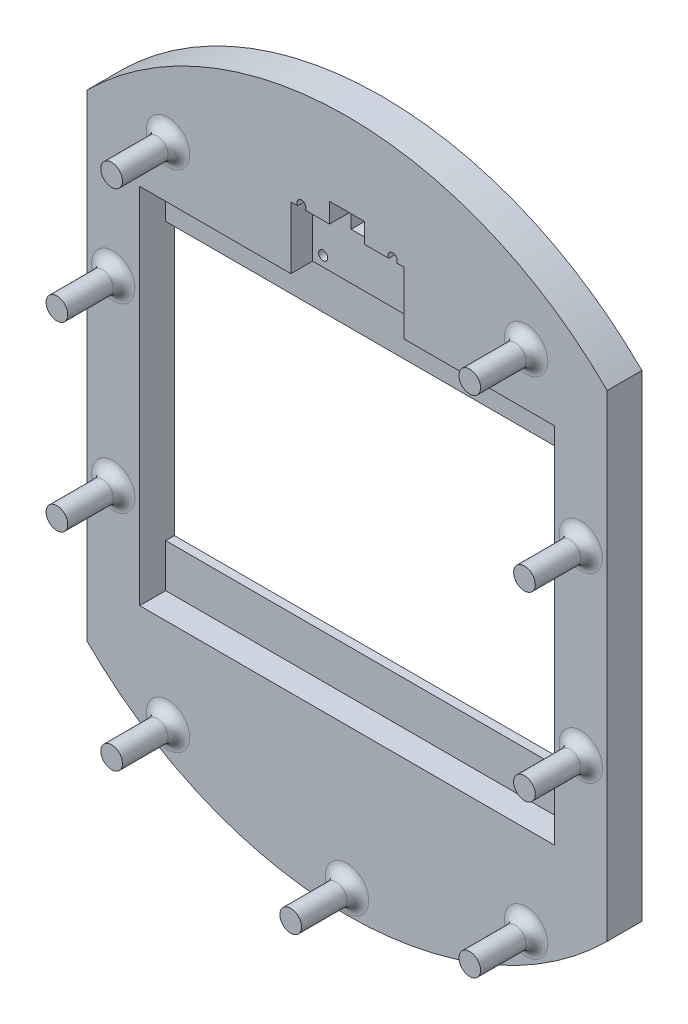
from build123d import *

# Parameters (mm, degrees)
ESBO_O1_W                = 95.625
ESBO_O1_H                = 63.75
RESSALTO_EXTRUS_O1_DEPTH = 8
ESBO_O2_W                = 95.625
ESBO_O2_H                = 83.75
CORTE_EXTRUS_O1_DEPTH    = 6
ESBO_O3_R                = 2.5
RESSALTO_EXTRUS_O2_DEPTH = 13
FILETE1_R                = 2.5
ESBO_O4_R                = 1.05
ESBO_O4_W                = 8.1
ESBO_O4_H                = 8.1
CORTE_EXTRUS_O2_DEPTH    = 14
CORTE_EXTRUS_O3_DEPTH    = 5


with BuildPart() as part:
    # Esboço1 → Ressalto-extrusão1 (new body)
    with BuildSketch(Plane.XY):
        with BuildLine():
            Line((0, 0), (0, -110))
            ThreePointArc((0, -110), (60, -134.792027106), (120, -110))
            Line((120, -110), (120, 0))
            ThreePointArc((120, 0), (60, 24.792027106), (0, 0))
        make_face()
        with Locations((60, -55)):
            Rectangle(ESBO_O1_W, ESBO_O1_H, mode=Mode.SUBTRACT)
    extrude(amount=RESSALTO_EXTRUS_O1_DEPTH)

    # Esboço2 → Corte-extrusão1 (cut)
    with BuildSketch(Plane.XY.offset(8)):
        with Locations((60, -55)):
            Rectangle(ESBO_O2_W, ESBO_O2_H)
    extrude(amount=-CORTE_EXTRUS_O1_DEPTH, mode=Mode.SUBTRACT)

    # Esboço3 → Ressalto-extrusão2 (add)
    with BuildSketch(Plane.XY.offset(8)):
        with Locations((18.70841508, -117.382967977)):
            Circle(ESBO_O3_R)
        with Locations((60, -129.382503442)):
            Circle(ESBO_O3_R)
        with Locations((101.29158492, -117.382967977)):
            Circle(ESBO_O3_R)
        with Locations((101.29158492, -1.064839346)):
            Circle(ESBO_O3_R)
        with Locations((18.70841508, -1.064839346)):
            Circle(ESBO_O3_R)
        with Locations((6.09375, -75.94)):
            Circle(ESBO_O3_R)
        with Locations((6.09375, -34.065)):
            Circle(ESBO_O3_R)
        with Locations((113.90625, -75.94)):
            Circle(ESBO_O3_R)
        with Locations((113.90625, -34.065)):
            Circle(ESBO_O3_R)
    extrude(amount=RESSALTO_EXTRUS_O2_DEPTH)

    # Filete1
    filete1_edges = [part.edges().sort_by_distance(p)[0] for p in [
        (16.20841508, -1.064839346, 8),
        (3.59375, -34.065, 8),
        (3.59375, -75.94, 8),
        (16.20841508, -117.382967977, 8),
        (57.5, -129.382503442, 8),
        (98.79158492, -117.382967977, 8),
        (111.40625, -75.94, 8),
        (111.40625, -34.065, 8),
        (98.79158492, -1.064839346, 8),
    ]]
    fillet(filete1_edges, radius=FILETE1_R)

    # Esboço4 → Corte-extrusão2 (cut)
    with BuildSketch(Plane.XY.offset(8)):
        with Locations((70.5, -10.765932159)):
            Circle(ESBO_O4_R)
        with Locations((70.5, 1.734067841)):
            Circle(ESBO_O4_R)
        with Locations((49.5, -10.765932159)):
            Circle(ESBO_O4_R)
        with Locations((49.5, 1.734067841)):
            Circle(ESBO_O4_R)
        with Locations((60, 1.734067841)):
            Rectangle(ESBO_O4_W, ESBO_O4_H)
    extrude(amount=-CORTE_EXTRUS_O2_DEPTH, mode=Mode.SUBTRACT)

    # Esboço5 → Corte-extrusão3 (cut)
    with BuildSketch(Plane.XY.offset(8)):
        Polygon((47.059331638, -13.125), (47.059331638, 1.210012927), (73.076022221, 1.210012927), (73.076022221, -25.383617561), (47.059331638, -25.383617561), align=None)
    extrude(amount=-CORTE_EXTRUS_O3_DEPTH, mode=Mode.SUBTRACT)


solid = part.part
